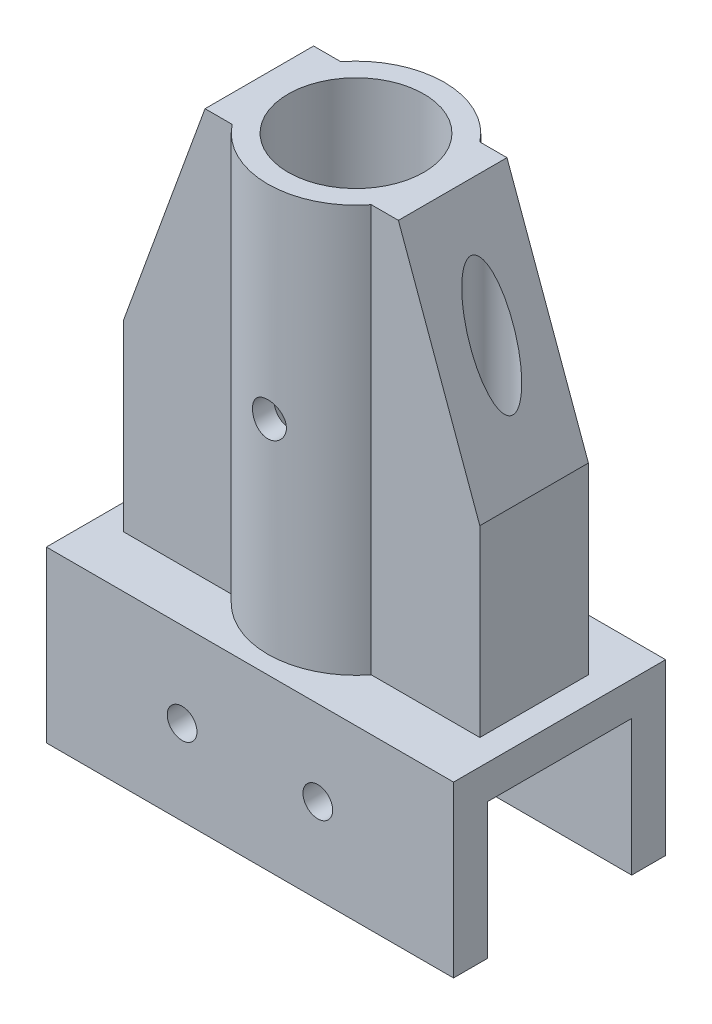
from build123d import *

# Parameters (mm, degrees)
SKETCH1_W                                 = 76.2
SKETCH1_H                                 = 39.6875
BASE_DEPTH                                = 6.35
SKETCH2_W                                 = 76.2
SKETCH2_H                                 = 6.35
WALLS_DEPTH                               = 25.4
SCREW_START                               = -39.6875
SCREW_HOLE_OUTLINE_R                      = 2.77876
SCREW_HOLE_DEPTH                          = 39.6875
HOLE_PATTERN_COUNT                        = 2
HOLE_PATTERN_PITCH                        = 25.4
TOP_SECTION_DEPTH                         = 76.2
BOLT_HOLE_CHAMFER_SIZE                    = 15.24
BOLT_HOLE_CHAMFER_SIZE2                   = 41.871555872
SKETCH24_R                                = 12.7
TEMP_POLE_HOLE_DEPTH                      = 76.2
SKETCH26_R                                = 3.96875
TEMP_BOLT_HOLES_DEPTH                     = 138.966445762
TOP_SECTION_BROOM_SUPPORT_HOLE_DEPTH      = 115.222803793
TOP_SECTION_BROOM_SUPPORT_HOLE_DEPTH_BACK = 115.222803793
SKETCH28_R                                = 3.175


# Read off the part's stored shape, not the designer's step: Screw hole
with BuildPart() as part:
    # Sketch1 → Base (new body)
    with BuildSketch(Plane(origin=(0, 0, 0), x_dir=(1, 0, 0), z_dir=(0, 1, 0))):
        with Locations((38.1, 19.84375)):
            Rectangle(SKETCH1_W, SKETCH1_H)
    extrude(amount=BASE_DEPTH)

    # Sketch2 → Walls (add)
    with BuildSketch(Plane.XZ):
        with Locations((38.1, -3.175)):
            Rectangle(SKETCH2_W, SKETCH2_H)
        with Locations((38.1, -36.5125)):
            Rectangle(SKETCH2_W, SKETCH2_H)
    extrude(amount=WALLS_DEPTH)

    # Screw hole outline → Screw hole (cut)
    with BuildSketch(Plane.XY.offset(SCREW_START)):
        with Locations((50.8, -9.525)):
            Circle(SCREW_HOLE_OUTLINE_R)
    screw_hole = extrude(amount=SCREW_HOLE_DEPTH, mode=Mode.SUBTRACT)

    # Hole pattern: Screw hole ×2
    with Locations(*[(-i * HOLE_PATTERN_PITCH, 0, 0) for i in range(1, HOLE_PATTERN_COUNT)]):
        add(screw_hole, mode=Mode.SUBTRACT)

    # Sketch7 → Top section (add)
    with BuildSketch(Plane(origin=(0, 6.35, 0), x_dir=(1, 0, 0), z_dir=(0, 1, 0))):
        with BuildLine():
            Line((4.766372527, 30.00375), (4.766372527, 9.68375))
            Line((4.766372527, 9.68375), (25.086372527, 9.68375))
            ThreePointArc((25.086372527, 9.68375), (21.59, 19.84375), (25.086372527, 30.00375))
            Line((25.086372527, 30.00375), (4.766372527, 30.00375))
        make_face()
        with BuildLine():
            ThreePointArc((25.086372527, 30.00375), (21.59, 19.84375), (25.086372527, 9.68375))
            Line((25.086372527, 9.68375), (25.086372527, 30.00375))
        make_face()
        with BuildLine():
            Line((25.086372527, 30.00375), (25.086372527, 9.68375))
            ThreePointArc((25.086372527, 9.68375), (38.1, 3.33375), (51.113627473, 9.68375))
            Line((51.113627473, 9.68375), (51.113627473, 30.00375))
            ThreePointArc((51.113627473, 30.00375), (38.1, 36.35375), (25.086372527, 30.00375))
        make_face()
        with BuildLine():
            Line((51.113627473, 30.00375), (51.113627473, 9.68375))
            ThreePointArc((51.113627473, 9.68375), (53.711455563, 14.471361778), (54.61, 19.84375))
            ThreePointArc((54.61, 19.84375), (53.711455563, 25.216138222), (51.113627473, 30.00375))
        make_face()
        with BuildLine():
            ThreePointArc((54.61, 19.84375), (53.711455563, 14.471361778), (51.113627473, 9.68375))
            Line((51.113627473, 9.68375), (71.433627473, 9.68375))
            Line((71.433627473, 9.68375), (71.433627473, 30.00375))
            Line((71.433627473, 30.00375), (51.113627473, 30.00375))
            ThreePointArc((51.113627473, 30.00375), (53.711455563, 25.216138222), (54.61, 19.84375))
        make_face()
    extrude(amount=TOP_SECTION_DEPTH)

    # Bolt hole chamfer
    bolt_hole_chamfer_edges = [part.edges().sort_by_distance(p)[0] for p in [
        (4.766372527, 82.55, -19.84375),
        (71.433627473, 82.55, -19.84375),
    ]]
    bolt_hole_chamfer_side = [part.faces().sort_by_distance(p)[0] for p in [
        (38.1, 82.55, -19.84375),
    ]]
    chamfer(bolt_hole_chamfer_edges, length=BOLT_HOLE_CHAMFER_SIZE, length2=BOLT_HOLE_CHAMFER_SIZE2, reference=bolt_hole_chamfer_side[0])

    # Sketch24 → Temp Pole Hole (cut)
    with BuildSketch(Plane(origin=(0, 82.55, 0), x_dir=(1, 0, 0), z_dir=(0, 1, 0))):
        with Locations(Location((38.1, 19.84375, 0), (0, 0, 270))):
            Circle(SKETCH24_R)
    extrude(amount=-TEMP_POLE_HOLE_DEPTH, mode=Mode.SUBTRACT)

    # Sketch26 → Temp bolt holes (cut, through all)
    with BuildSketch(Plane(origin=(0, 82.55, 0), x_dir=(1, 0, 0), z_dir=(0, 1, 0))):
        with Locations((12.7, 19.84375)):
            Circle(SKETCH26_R)
    temp_bolt_holes = extrude(amount=-TEMP_BOLT_HOLES_DEPTH, mode=Mode.SUBTRACT)

    # Temp bolt hole mirror: Temp bolt holes across plane
    add(temp_bolt_holes.mirror(Plane(origin=(38.1, 0, 0), x_dir=(0, 0, 1), z_dir=(1, 0, 0))), mode=Mode.SUBTRACT)

    # Sketch28 → Top section broom support hole (cut, two sides: drawn at the far end of the back side and taken through both)
    with BuildSketch(Plane.XY.offset(-19.05).offset(-TOP_SECTION_BROOM_SUPPORT_HOLE_DEPTH_BACK)):
        with Locations((38.1, 44.45)):
            Circle(SKETCH28_R)
    extrude(amount=TOP_SECTION_BROOM_SUPPORT_HOLE_DEPTH + TOP_SECTION_BROOM_SUPPORT_HOLE_DEPTH_BACK, mode=Mode.SUBTRACT)


solid = part.part
